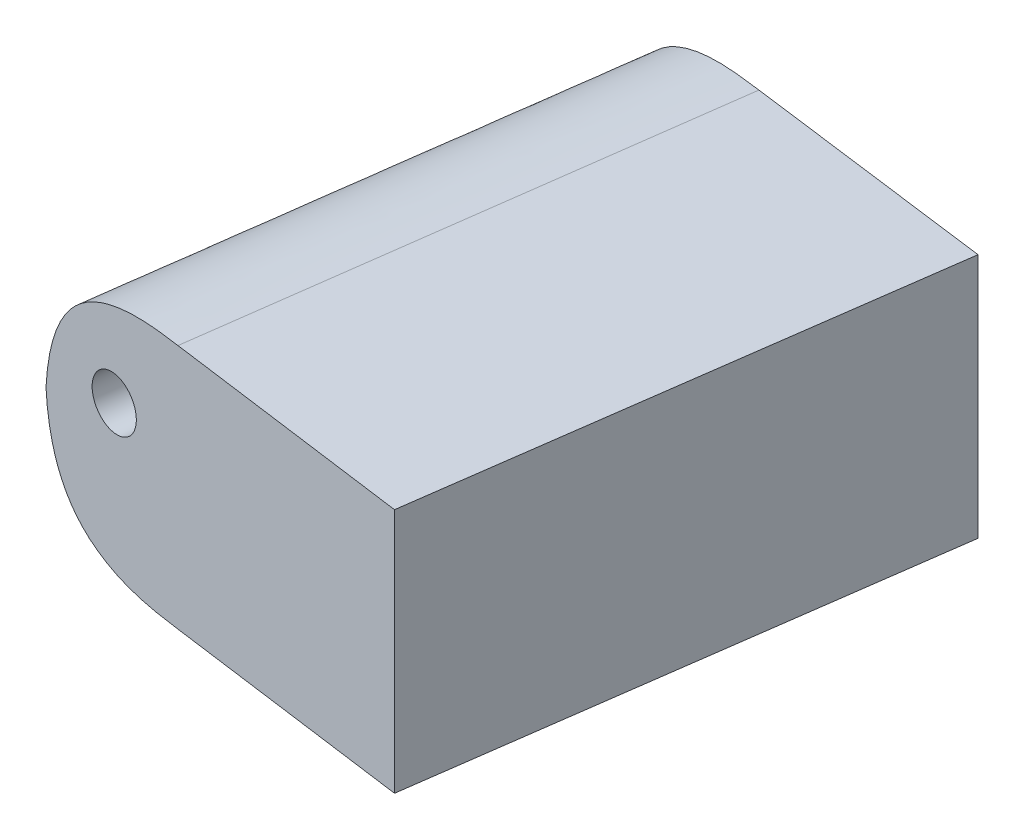
from build123d import *

# Parameters (mm, degrees)
BOSS_EXTRUDE1_DEPTH = 9.525
SKETCH3_R           = 2.032
CUT_EXTRUDE1_DEPTH  = 2.7
SKETCH4_R           = 1.000000032
CUT_EXTRUDE2_DEPTH  = 49.829451626
FILLET2_SIZE        = 6


with BuildPart() as part:
    # Sketch1 → Boss-Extrude1 (new body)
    with BuildSketch(Plane(origin=(0, 0, 0), x_dir=(1, 0, 0), z_dir=(0, 1, 0))):
        Polygon((-29.626544256, -8.559809399), (-45.282501527, -6.441378612), (-42.600711235, 13.378005859), (-26.876432388, 11.317015404), align=None)
    extrude(amount=BOSS_EXTRUDE1_DEPTH)

    # Sketch3 → Cut-Extrude1 (cut)
    with BuildSketch(Plane(origin=(1.004349985, 0, -7.662664899), x_dir=(-0.9915193653276276, 0, -0.12995902500518686), z_dir=(0.12995902500518686, 0, -0.9915193653276276))):
        with Locations((40.946022732, 5.969)):
            Circle(SKETCH3_R)
    extrude(amount=-CUT_EXTRUDE1_DEPTH, mode=Mode.SUBTRACT)

    # Sketch4 → Cut-Extrude2 (cut, through all)
    with BuildSketch(Plane(origin=(0.653460617, 0, -4.985562613), x_dir=(-0.9915193653276276, 0, -0.12995902500518688), z_dir=(0.12995902500518688, 0, -0.9915193653276276))):
        with Locations((40.946022732, 5.969)):
            Circle(SKETCH4_R)
    extrude(amount=-CUT_EXTRUDE2_DEPTH, mode=Mode.SUBTRACT)

    # Fillet2
    # a fillet whose section is not a circle: 6 mm, written as the material it takes off along each edge
    with BuildSketch(Plane(origin=(-47.293844247, 9.525, 21.305916966), x_dir=(0.9909692235697757, 0, 0.13408951464419594), z_dir=(0.13408951464419594, 0, -0.9909692235697757))) as fillet2_piece_1:
        with BuildLine():
            add(Edge.make_bspline([(FILLET2_SIZE, 0), (FILLET2_SIZE * 0.831801948466, 0), (FILLET2_SIZE * 0.663603896932, 0), (FILLET2_SIZE * 0.292893218813, FILLET2_SIZE * 0.0716919198361), (FILLET2_SIZE * 0.0716919198361, FILLET2_SIZE * 0.292893218813), (0, FILLET2_SIZE * 0.663603896932), (0, FILLET2_SIZE * 0.831801948466), (0, FILLET2_SIZE)], knots=[0, 0, 0, 0, 0, 0, 0.5, 0.5, 1, 1, 1, 1, 1, 1], degree=5))
            Line((0, FILLET2_SIZE), (0, 0))
            Line((0, 0), (FILLET2_SIZE, 0))
        make_face()
    extrude(amount=50, mode=Mode.SUBTRACT)
    with BuildSketch(Plane(origin=(-47.293844247, 0, 21.305916966), x_dir=(0.9909692235697757, 0, 0.13408951464419594), z_dir=(0.13408951464419594, 0, -0.9909692235697757))) as fillet2_piece_2:
        with BuildLine():
            add(Edge.make_bspline([(FILLET2_SIZE, 0), (FILLET2_SIZE * 0.831801948466, 0), (FILLET2_SIZE * 0.663603896932, 0), (FILLET2_SIZE * 0.292893218813, -FILLET2_SIZE * 0.0716919198361), (FILLET2_SIZE * 0.0716919198361, -FILLET2_SIZE * 0.292893218813), (0, -FILLET2_SIZE * 0.663603896932), (0, -FILLET2_SIZE * 0.831801948466), (0, -FILLET2_SIZE)], knots=[0, 0, 0, 0, 0, 0, 0.5, 0.5, 1, 1, 1, 1, 1, 1], degree=5))
            Line((0, -FILLET2_SIZE), (0, 0))
            Line((0, 0), (FILLET2_SIZE, 0))
        make_face()
    extrude(amount=50, mode=Mode.SUBTRACT)


solid = part.part
